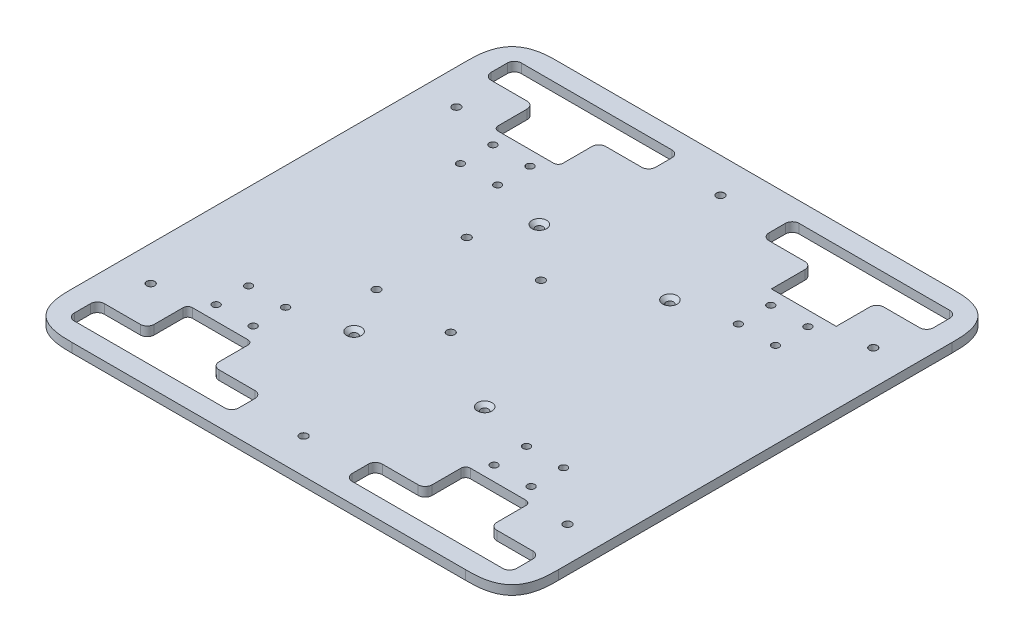
from build123d import *

# Parameters (mm, degrees)
SKETCH_1_W                    = 210
SKETCH_1_H                    = 210
EXTRUDE_1_DEPTH               = 4
FILLET_1_SIZE                 = 20
HOLE_WIZARD_M31_D             = 3.15
HOLE_WIZARD_M31_DEPTH         = 8
HOLE_WIZARD_M31_TIP           = 0.946355475
HOLE_WIZARD_M35_D             = 3.4
HOLE_WIZARD_M35_CSINK_D       = 3.45
HOLE_WIZARD_M35_CSINK_ANGLE   = 90
HOLE_WIZARD_M31_2_D           = 3.2
HOLE_WIZARD_M31_2_DEPTH       = 4
HOLE_WIZARD_M31_2_CSINK_D     = 6.3
HOLE_WIZARD_M31_2_CSINK_ANGLE = 90
HOLE_WIZARD_M31_2_TIP         = 0.96137699
SKETCH_45_W                   = 71
SKETCH_45_H                   = 13
CUT_EXTRUDE_3_DEPTH           = 149.546289226
CUT_EXTRUDE_2_REACH           = 150.546
SKETCH_17_W                   = 28
SKETCH_17_H                   = 13.5
SKETCH_17_H_2                 = 4
FILLET_2_R                    = 2
FILLET_3_R                    = 3
FILLET_5_R                    = 3
HOLE_WIZARD_M32_D             = 3.4
HOLE_WIZARD_M32_CSINK_D       = 6.3
HOLE_WIZARD_M32_CSINK_ANGLE   = 90


with BuildPart() as part:
    # Эскиз1 → Бобышка-Вытянуть1 (new body)
    with BuildSketch(Plane(origin=(0, 0, 0), x_dir=(1, 0, 0), z_dir=(0, 1, 0))):
        Rectangle(SKETCH_1_W, SKETCH_1_H)
    extrude(amount=EXTRUDE_1_DEPTH)

    # Скругление1
    # a fillet whose section is not a circle: 20 mm, written as the material it takes off along each edge
    with BuildSketch(Plane(origin=(-105, -50, -105), x_dir=(1, 0, 0), z_dir=(0, 1, 0)), Plane(origin=(105, -50, -105), x_dir=(0, 0, 1), z_dir=(0, 1, 0)), Plane(origin=(105, -50, 105), x_dir=(-1, 0, 0), z_dir=(0, 1, 0))) as fillet_1_piece_1:
        with BuildLine():
            add(Edge.make_bspline([(FILLET_1_SIZE, 0), (FILLET_1_SIZE * 0.831801948466, 0), (FILLET_1_SIZE * 0.663603896932, 0), (FILLET_1_SIZE * 0.292893218813, -FILLET_1_SIZE * 0.0716919198361), (FILLET_1_SIZE * 0.0716919198361, -FILLET_1_SIZE * 0.292893218813), (0, -FILLET_1_SIZE * 0.663603896932), (0, -FILLET_1_SIZE * 0.831801948466), (0, -FILLET_1_SIZE)], knots=[0, 0, 0, 0, 0, 0, 0.5, 0.5, 1, 1, 1, 1, 1, 1], degree=5))
            Line((0, -FILLET_1_SIZE), (0, 0))
            Line((0, 0), (FILLET_1_SIZE, 0))
        make_face()
    extrude(amount=104, mode=Mode.SUBTRACT)
    with BuildSketch(Plane(origin=(-105, -50, 105), x_dir=(1, 0, 0), z_dir=(0, 1, 0))) as fillet_1_piece_2:
        with BuildLine():
            add(Edge.make_bspline([(FILLET_1_SIZE, 0), (FILLET_1_SIZE * 0.831801948466, 0), (FILLET_1_SIZE * 0.663603896932, 0), (FILLET_1_SIZE * 0.292893218813, FILLET_1_SIZE * 0.0716919198361), (FILLET_1_SIZE * 0.0716919198361, FILLET_1_SIZE * 0.292893218813), (0, FILLET_1_SIZE * 0.663603896932), (0, FILLET_1_SIZE * 0.831801948466), (0, FILLET_1_SIZE)], knots=[0, 0, 0, 0, 0, 0, 0.5, 0.5, 1, 1, 1, 1, 1, 1], degree=5))
            Line((0, FILLET_1_SIZE), (0, 0))
            Line((0, 0), (FILLET_1_SIZE, 0))
        make_face()
    extrude(amount=104, mode=Mode.SUBTRACT)

    # Hole Wizard M31
    with Locations(Plane(origin=(0, 4, 0), x_dir=(1, 0, 0), z_dir=(0, 1, 0))):
        with Locations((-68, 59.75), (-52, 59.75), (-68, 45.75), (-52, 45.75), (-52, -59.75), (-52, -45.75), (-68, -59.75), (52, -59.75), (52, -45.75), (68, -59.75), (68, -45.75), (52, 59.75), (52, 45.75), (-68, -45.75), (68, 45.75), (68, 59.75)):
            Hole(HOLE_WIZARD_M31_D / 2, depth=HOLE_WIZARD_M31_DEPTH)
            with Locations((0, 0, -(HOLE_WIZARD_M31_DEPTH + HOLE_WIZARD_M31_TIP / 2))):  # 118° drill point
                Cone(0, HOLE_WIZARD_M31_D / 2, HOLE_WIZARD_M31_TIP, mode=Mode.SUBTRACT)

    # Отверстие с зазором M35 (through all)
    with Locations(Plane(origin=(0, 4, 0), x_dir=(1, 0, 0), z_dir=(0, 1, 0))):
        with Locations((90, 66), (-90, 66), (-90, -66), (90, -66), (0, -90), (0, 90)):
            CounterSinkHole(HOLE_WIZARD_M35_D / 2, HOLE_WIZARD_M35_CSINK_D / 2, counter_sink_angle=HOLE_WIZARD_M35_CSINK_ANGLE)

    # Hole Wizard M31 2
    with Locations(Plane(origin=(0, 4, 0), x_dir=(1, 0, 0), z_dir=(0, 1, 0))):
        with Locations((28.2, 40), (-28.2, 40), (-28.2, -40), (28.2, -40)):
            CounterSinkHole(HOLE_WIZARD_M31_2_D / 2, HOLE_WIZARD_M31_2_CSINK_D / 2, depth=HOLE_WIZARD_M31_2_DEPTH, counter_sink_angle=HOLE_WIZARD_M31_2_CSINK_ANGLE)
            with Locations((0, 0, -(HOLE_WIZARD_M31_2_DEPTH + HOLE_WIZARD_M31_2_TIP / 2))):  # 118° drill point
                Cone(0, HOLE_WIZARD_M31_2_D / 2, HOLE_WIZARD_M31_2_TIP, mode=Mode.SUBTRACT)

    # Эскиз45 → Вырез-Вытянуть3 (cut, through all)
    with BuildSketch(Plane(origin=(0, 4, 0), x_dir=(1, 0, 0), z_dir=(0, 1, 0))):
        with Locations((-60, 90)):
            Rectangle(SKETCH_45_W, SKETCH_45_H)
        with Locations((-60, -90)):
            Rectangle(SKETCH_45_W, SKETCH_45_H)
        with Locations((60, -90)):
            Rectangle(SKETCH_45_W, SKETCH_45_H)
        with Locations((60, 90)):
            Rectangle(SKETCH_45_W, SKETCH_45_H)
    extrude(amount=-CUT_EXTRUDE_3_DEPTH, mode=Mode.SUBTRACT)

    # Эскиз17 → Вырез-Вытянуть2 (cut, up to next)
    with BuildSketch(Plane(origin=(0, 4, 0), x_dir=(1, 0, 0), z_dir=(0, 1, 0)), mode=Mode.PRIVATE) as cut_extrude_2_sk1:
        with Locations((-60, 76.75)):
            Rectangle(SKETCH_17_W, SKETCH_17_H)
    cut_extrude_2_tool1 = extrude(cut_extrude_2_sk1.sketch, amount=-CUT_EXTRUDE_2_REACH, mode=Mode.PRIVATE) & part.part
    # Эскиз17 → Вырез-Вытянуть2 (cut, up to next)
    with BuildSketch(Plane(origin=(0, 4, 0), x_dir=(1, 0, 0), z_dir=(0, 1, 0)), mode=Mode.PRIVATE) as cut_extrude_2_sk2:
        with Locations((-60, 68)):
            Rectangle(SKETCH_17_W, SKETCH_17_H_2)
    cut_extrude_2_tool2 = extrude(cut_extrude_2_sk2.sketch, amount=-CUT_EXTRUDE_2_REACH, mode=Mode.PRIVATE) & part.part
    # Эскиз17 → Вырез-Вытянуть2 (cut, up to next)
    with BuildSketch(Plane(origin=(0, 4, 0), x_dir=(1, 0, 0), z_dir=(0, 1, 0)), mode=Mode.PRIVATE) as cut_extrude_2_sk3:
        Polygon((-46, -70), (-46, -83.5), (-74, -83.5), (-74, -70), (-74, -66), (-46, -66), align=None)
    cut_extrude_2_tool3 = extrude(cut_extrude_2_sk3.sketch, amount=-CUT_EXTRUDE_2_REACH, mode=Mode.PRIVATE) & part.part
    # Эскиз17 → Вырез-Вытянуть2 (cut, up to next)
    with BuildSketch(Plane(origin=(0, 4, 0), x_dir=(1, 0, 0), z_dir=(0, 1, 0)), mode=Mode.PRIVATE) as cut_extrude_2_sk4:
        Polygon((74, -83.5), (46, -83.5), (46, -70), (46, -66), (74, -66), (74, -70), align=None)
    cut_extrude_2_tool4 = extrude(cut_extrude_2_sk4.sketch, amount=-CUT_EXTRUDE_2_REACH, mode=Mode.PRIVATE) & part.part
    # Эскиз17 → Вырез-Вытянуть2 (cut, up to next)
    with BuildSketch(Plane(origin=(0, 4, 0), x_dir=(1, 0, 0), z_dir=(0, 1, 0)), mode=Mode.PRIVATE) as cut_extrude_2_sk5:
        Polygon((46, 70), (46, 83.5), (74, 83.5), (74, 70), (74, 66), (46, 66), align=None)
    cut_extrude_2_tool5 = extrude(cut_extrude_2_sk5.sketch, amount=-CUT_EXTRUDE_2_REACH, mode=Mode.PRIVATE) & part.part
    add(cut_extrude_2_tool1.solids().sort_by_distance((-60, 4, -76.75))[0], mode=Mode.SUBTRACT)
    add(cut_extrude_2_tool2.solids().sort_by_distance((-60, 4, -68))[0], mode=Mode.SUBTRACT)
    add(cut_extrude_2_tool3.solids().sort_by_distance((-60, 4, 74.75))[0], mode=Mode.SUBTRACT)
    add(cut_extrude_2_tool4.solids().sort_by_distance((60, 4, 74.75))[0], mode=Mode.SUBTRACT)
    add(cut_extrude_2_tool5.solids().sort_by_distance((60, 4, -74.75))[0], mode=Mode.SUBTRACT)

    # Скругление2
    fillet_2_edges = [part.edges().sort_by_distance(p)[0] for p in [
        (46, 2, 66),
        (74, 2, 66),
        (-46, 2, 66),
        (-74, 2, 66),
        (-74, 2, -66),
        (-46, 2, -66),
    ]]
    fillet(fillet_2_edges, radius=FILLET_2_R)

    # Скругление3
    fillet_3_edges = [part.edges().sort_by_distance(p)[0] for p in [
        (46, 2, -83.5),
        (74, 2, -83.5),
        (74, 2, 83.5),
        (46, 2, 83.5),
        (-46, 2, 83.5),
        (-74, 2, 83.5),
        (-74, 2, -83.5),
        (-46, 2, -83.5),
    ]]
    fillet(fillet_3_edges, radius=FILLET_3_R)

    # Скругление5
    fillet_5_edges = [part.edges().sort_by_distance(p)[0] for p in [
        (-95.5, 2, 83.5),
        (-24.5, 2, 83.5),
        (-24.5, 2, 96.5),
        (-95.5, 2, 96.5),
        (95.5, 2, 96.5),
        (24.5, 2, 96.5),
        (24.5, 2, 83.5),
        (95.5, 2, 83.5),
        (95.5, 2, -83.5),
        (24.5, 2, -83.5),
        (24.5, 2, -96.5),
        (95.5, 2, -96.5),
        (-24.5, 2, -96.5),
        (-24.5, 2, -83.5),
        (-95.5, 2, -83.5),
        (-95.5, 2, -96.5),
    ]]
    fillet(fillet_5_edges, radius=FILLET_5_R)

    # Зенковка для винта с полупотайной головкой M32 (through all)
    with Locations(Plane(origin=(0, 0, 0), x_dir=(-1, 0, 0), z_dir=(0, -1, 0))):
        with Locations((39.01939717, 19.466602706), (6.98060283, 19.466602706), (6.98060283, -19.466602706), (39.01939717, -19.466602706)):
            CounterSinkHole(HOLE_WIZARD_M32_D / 2, HOLE_WIZARD_M32_CSINK_D / 2, counter_sink_angle=HOLE_WIZARD_M32_CSINK_ANGLE)


solid = part.part
